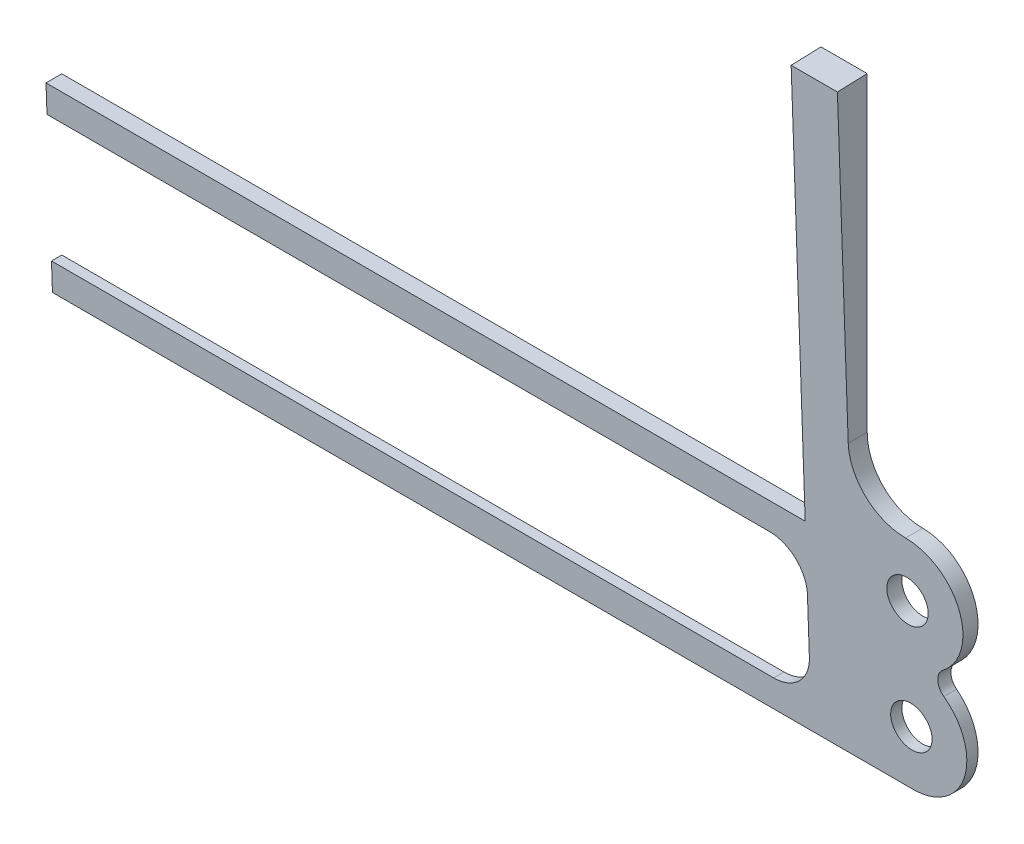
from build123d import *

# Parameters (mm, degrees)
BOSS_EXTRUDE1_OUTLINE_R = 3.556
BOSS_EXTRUDE1_OUTLINE_W = 260.9469
BOSS_EXTRUDE1_OUTLINE_H = 138.1252
BOSS_EXTRUDE1_DEPTH     = 76.2
CUT_EXTRUDE1_DEPTH      = 355.32482824
CUT_EXTRUDE1_DEPTH_BACK = 355.32482824
FILLET1_R               = 2.54
SKETCH7_W               = 260.9469
SKETCH7_H               = 22.1996
CUT_EXTRUDE2_DEPTH      = 347.152897849
FILLET2_R               = 6.35
SKETCH8_W               = 190.775627824
SKETCH8_H               = 235.521960295
CUT_EXTRUDE4_DEPTH      = 347.144751077
SKETCH9_W               = 166.035784577
SKETCH9_H               = 113.418104201
CUT_EXTRUDE5_DEPTH      = 227.747805823


# Read off the part's stored shape, not the designer's step: Boss-Extrude1
with BuildPart() as part:
    # Boss-Extrude1 outline → Boss-Extrude1 (new body)
    with BuildSketch(Plane.XY):
        with BuildLine():
            Line((-286.3596, -22.225), (9.525, -22.225))
            ThreePointArc((9.525, -22.225), (19.05, -12.7), (9.525, -3.175))
            ThreePointArc((9.525, -3.175), (19.05, 6.35), (9.525, 15.875))
            ThreePointArc((9.525, 15.875), (2.789807909, 18.664807909), (0, 25.4))
            Line((0, 25.4), (0, 131.7752))
            ThreePointArc((0, 131.7752), (2.789807909, 138.510392091), (9.525, 141.3002))
            ThreePointArc((9.525, 141.3002), (19.05, 150.8252), (9.525, 160.3502))
            ThreePointArc((9.525, 160.3502), (19.05, 169.8752), (9.525, 179.4002))
            Line((9.525, 179.4002), (-6.35, 179.4002))
            Line((-6.35, 179.4002), (-6.35, 163.5252))
            Line((-6.35, 163.5252), (-7.9502, 163.5252))
            Line((-7.9502, 163.5252), (-7.9502, 160.3502))
            Line((-7.9502, 160.3502), (-268.9098, 160.3502))
            Line((-268.9098, 160.3502), (-268.9098, 163.5252))
            Line((-268.9098, 163.5252), (-270.51, 163.5252))
            Line((-270.51, 163.5252), (-270.51, 179.4002))
            Line((-270.51, 179.4002), (-286.385, 179.4002))
            ThreePointArc((-286.385, 179.4002), (-295.91, 169.8752), (-286.385, 160.3502))
            ThreePointArc((-286.385, 160.3502), (-295.897297883, 150.818850004), (-286.3723, 141.3002))
            ThreePointArc((-286.3723, 141.3002), (-279.637107909, 138.510392091), (-276.8473, 131.7752))
            Line((-276.8473, 131.7752), (-276.8473, 25.4))
            ThreePointArc((-276.8473, 25.4), (-279.637107909, 18.664807909), (-286.3723, 15.875))
            ThreePointArc((-286.3723, 15.875), (-295.8973, 6.35), (-286.3723, -3.175))
            ThreePointArc((-286.3723, -3.175), (-295.884597883, -12.706349996), (-286.3596, -22.225))
        make_face()
        with Locations((-286.3596, -12.7)):
            Circle(BOSS_EXTRUDE1_OUTLINE_R, mode=Mode.SUBTRACT)
        with Locations((-286.3723, 6.35)):
            Circle(BOSS_EXTRUDE1_OUTLINE_R, mode=Mode.SUBTRACT)
        with Locations((9.525, -12.7)):
            Circle(BOSS_EXTRUDE1_OUTLINE_R, mode=Mode.SUBTRACT)
        with Locations((9.525, 6.35)):
            Circle(BOSS_EXTRUDE1_OUTLINE_R, mode=Mode.SUBTRACT)
        with Locations((-286.3723, 150.8252)):
            Circle(BOSS_EXTRUDE1_OUTLINE_R, mode=Mode.SUBTRACT)
        with Locations((-286.385, 169.8752)):
            Circle(BOSS_EXTRUDE1_OUTLINE_R, mode=Mode.SUBTRACT)
        with Locations((-138.42365, 78.5876)):
            Rectangle(BOSS_EXTRUDE1_OUTLINE_W, BOSS_EXTRUDE1_OUTLINE_H, mode=Mode.SUBTRACT)
        with Locations((9.525, 150.8252)):
            Circle(BOSS_EXTRUDE1_OUTLINE_R, mode=Mode.SUBTRACT)
        with Locations((9.525, 169.8752)):
            Circle(BOSS_EXTRUDE1_OUTLINE_R, mode=Mode.SUBTRACT)
    extrude(amount=BOSS_EXTRUDE1_DEPTH)

    # Sketch5 → Cut-Extrude1 (cut, two sides: drawn at the far end of the back side and taken through both)
    with BuildSketch(Plane.ZY.offset(276.8473).offset(-CUT_EXTRUDE1_DEPTH_BACK)):
        Polygon((1.6002, -22.225), (8.641107133, 179.4002), (76.2, 179.4002), (76.2, -22.225), align=None)
    extrude(amount=CUT_EXTRUDE1_DEPTH + CUT_EXTRUDE1_DEPTH_BACK, mode=Mode.SUBTRACT)

    # Fillet1
    fillet1_edges = [part.edges().sort_by_distance(p)[0] for p in [
        (-286.385, 160.3502, 3.987933237),
        (-286.3723, -3.175, 1.132720329),
        (9.525, -3.175, 1.132720329),
        (9.525, 160.3502, 3.987933237),
    ]]
    fillet(fillet1_edges, radius=FILLET1_R)

    # Sketch7 → Cut-Extrude2 (cut, through all)
    with BuildSketch(Plane(origin=(0, 0, 0), x_dir=(-1, 0, 0), z_dir=(0, 0, -1))):
        with Locations((138.42365, -6.35)):
            Rectangle(SKETCH7_W, SKETCH7_H)
    extrude(amount=-CUT_EXTRUDE2_DEPTH, mode=Mode.SUBTRACT)

    # Fillet2
    fillet2_edges = [part.edges().sort_by_distance(p)[0] for p in [
        (-268.8971, 4.7498, 1.271090386),
        (-268.8971, -17.4498, 0.883476829),
        (-7.9502, -17.4498, 0.883476829),
        (-7.9502, 4.7498, 1.271090386),
    ]]
    fillet(fillet2_edges, radius=FILLET2_R)

    # Sketch8 → Cut-Extrude4 (cut, through all)
    with BuildSketch(Plane(origin=(0, -0.082881646, 2.373419811), x_dir=(1, 0, 0), z_dir=(0, -0.03489949670250444, 0.9993908270190958))):
        with Locations((-233.811463912, 74.917246318)):
            Rectangle(SKETCH8_W, SKETCH8_H)
    extrude(amount=-CUT_EXTRUDE4_DEPTH, mode=Mode.SUBTRACT)

    # Sketch9 → Cut-Extrude5 (cut, through all)
    with BuildSketch(Plane(origin=(0, -0.082881646, 2.373419811), x_dir=(1, 0, 0), z_dir=(0, -0.03489949670250444, 0.9993908270190958))):
        with Locations((-55.405757712, 135.427486891)):
            Rectangle(SKETCH9_W, SKETCH9_H)
    extrude(amount=-CUT_EXTRUDE5_DEPTH, mode=Mode.SUBTRACT)


solid = part.part
